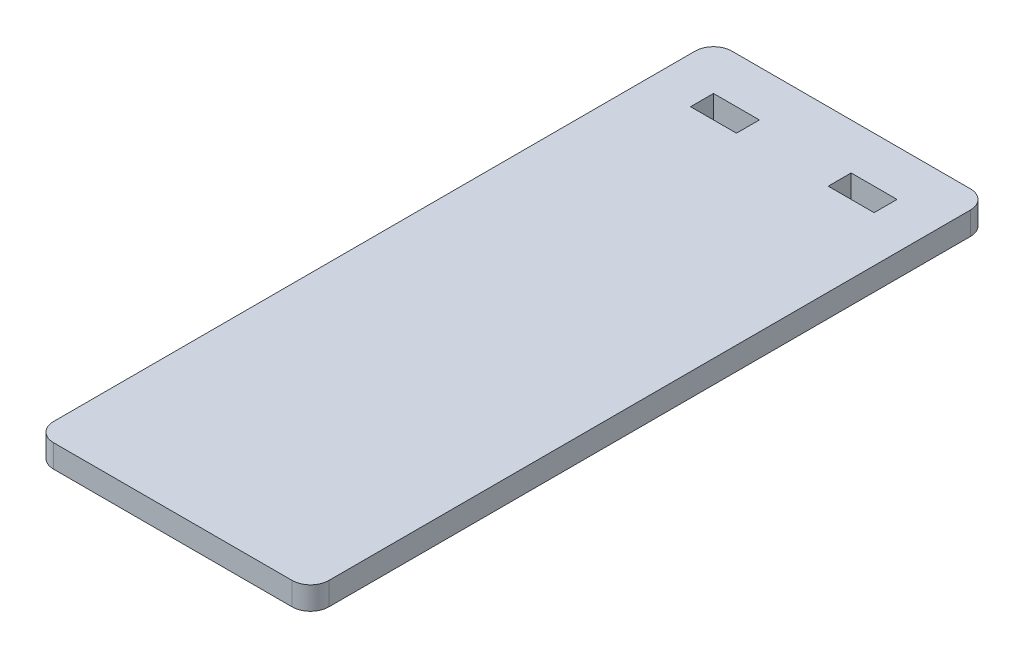
from build123d import *

# Parameters (mm, degrees)
SKETCH1_W           = 38.1
SKETCH1_H           = 93.875
BOSS_EXTRUDE1_DEPTH = 3.175
SKETCH2_W           = 6.35
SKETCH2_H           = 3.175
CUT_EXTRUDE1_DEPTH  = 102.361759308
FILLET1_R           = 2.54


with BuildPart() as part:
    # Sketch1 → Boss-Extrude1 (new body)
    with BuildSketch(Plane(origin=(0, 0, 0), x_dir=(1, 0, 0), z_dir=(0, 1, 0))):
        with Locations((19.05, 46.9375)):
            Rectangle(SKETCH1_W, SKETCH1_H)
    extrude(amount=BOSS_EXTRUDE1_DEPTH)

    # Sketch2 → Cut-Extrude1 (cut, through all)
    with BuildSketch(Plane(origin=(0, 3.175, 0), x_dir=(1, 0, 0), z_dir=(0, 1, 0))):
        with Locations((9.525, 85.9375)):
            Rectangle(SKETCH2_W, SKETCH2_H)
        with Locations((28.575, 85.9375)):
            Rectangle(SKETCH2_W, SKETCH2_H)
    extrude(amount=-CUT_EXTRUDE1_DEPTH, mode=Mode.SUBTRACT)

    # Fillet1
    fillet1_edges = [part.edges().sort_by_distance(p)[0] for p in [
        (38.1, 1.5875, 0),
        (0, 1.5875, 0),
        (38.1, 1.5875, -93.875),
        (0, 1.5875, -93.875),
    ]]
    fillet(fillet1_edges, radius=FILLET1_R)


solid = part.part
